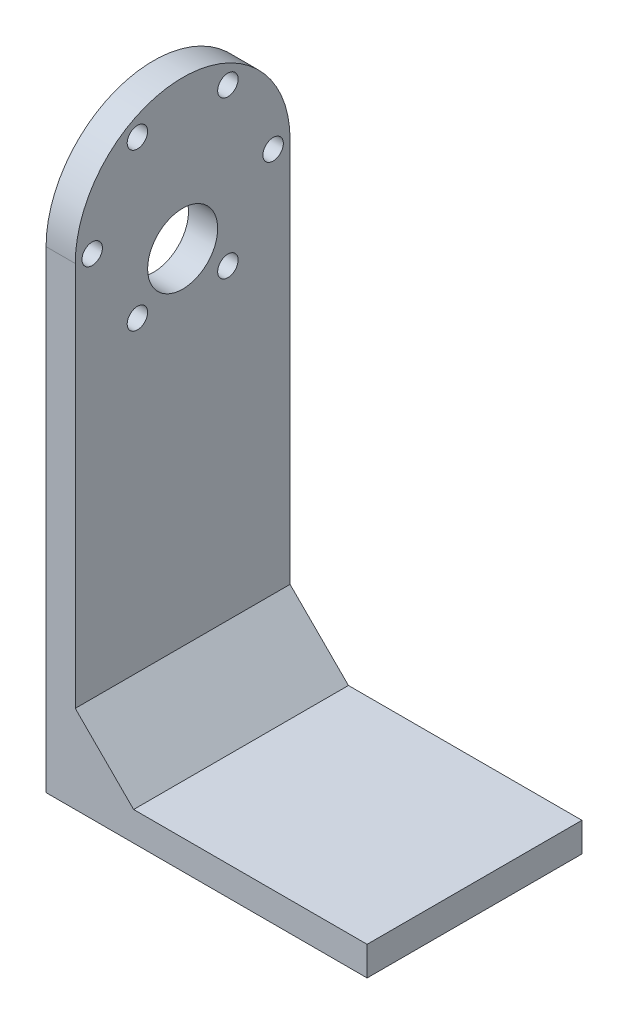
from build123d import *

# Parameters (mm, degrees)
SZKIC1_R                    = 1.75
SZKIC1_R_2                  = 6
DODANIE_WYCI_GNI_CIE1_DEPTH = 5
SZKIC2_W                    = 36.8
SZKIC2_H                    = 5
DODANIE_WYCI_GNI_CIE2_DEPTH = 50
SFAZOWANIE1_SIZE            = 10


with BuildPart() as part:
    # Szkic1 → Dodanie-wyciągnięcie1 (new body)
    with BuildSketch(Plane.ZY.offset(-752.608350006)):
        with BuildLine():
            Line((1140.860111381, -2000), (1140.860111381, -1919))
            ThreePointArc((1140.860111381, -1919), (1122.460111381, -1900.6), (1104.060111381, -1919))
            Line((1104.060111381, -1919), (1104.060111381, -2000))
            Line((1104.060111381, -2000), (1140.860111381, -2000))
        make_face()
        with Locations((1114.710111381, -1932.423393759)):
            Circle(SZKIC1_R, mode=Mode.SUBTRACT)
        with Locations((1122.460111381, -1926)):
            Circle(SZKIC1_R_2, mode=Mode.SUBTRACT)
        with Locations((1106.960111381, -1919)):
            Circle(SZKIC1_R, mode=Mode.SUBTRACT)
        with Locations((1114.710111381, -1905.576606241)):
            Circle(SZKIC1_R, mode=Mode.SUBTRACT)
        with Locations((1130.210111381, -1932.423393759)):
            Circle(SZKIC1_R, mode=Mode.SUBTRACT)
        with Locations((1130.210111381, -1905.576606241)):
            Circle(SZKIC1_R, mode=Mode.SUBTRACT)
        with Locations((1137.960111381, -1919)):
            Circle(SZKIC1_R, mode=Mode.SUBTRACT)
    extrude(amount=DODANIE_WYCI_GNI_CIE1_DEPTH)

    # Szkic2 → Dodanie-wyciągnięcie2 (add)
    with BuildSketch(Plane.ZY.offset(-752.608350006)):
        with Locations((1122.460111381, -1997.5)):
            Rectangle(SZKIC2_W, SZKIC2_H)
    extrude(amount=-DODANIE_WYCI_GNI_CIE2_DEPTH)

    # Sfazowanie1
    sfazowanie1_edges = [part.edges().sort_by_distance(p)[0] for p in [
        (752.608350006, -1995, 1122.460111381),
    ]]
    chamfer(sfazowanie1_edges, length=SFAZOWANIE1_SIZE)


solid = part.part
